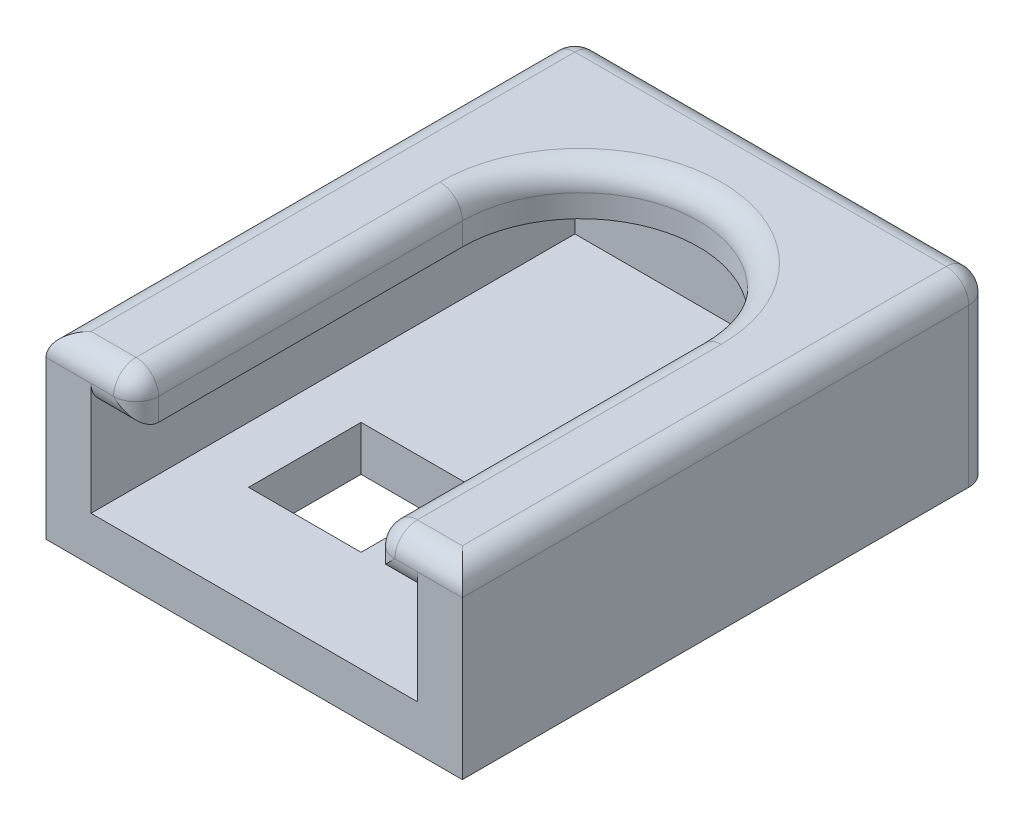
from build123d import *

# Parameters (mm, degrees)
SKETCH1_W           = 14.5
SKETCH1_H           = 21.5
BOSS_EXTRUDE1_DEPTH = 6
SHELL1_T            = 2
SKETCH3_W           = 2
SKETCH3_H           = 14.5
BOSS_EXTRUDE3_DEPTH = 2
SKETCH4_W           = 5
SKETCH4_H           = 5
CUT_EXTRUDE1_DEPTH  = 2
FILLET1_R           = 1


with BuildPart() as part:
    # Sketch1 → Boss-Extrude1 (new body)
    with BuildSketch(Plane(origin=(0, 0, 0), x_dir=(1, 0, 0), z_dir=(0, 1, 0))):
        Rectangle(SKETCH1_W, SKETCH1_H)
    extrude(amount=BOSS_EXTRUDE1_DEPTH)

    # Shell1
    shell1_openings = [part.faces().sort_by_distance(p)[0] for p in [
        (0, 3, 10.75),
        (0, 6, 0),
    ]]
    offset(amount=SHELL1_T, openings=shell1_openings, kind=Kind.INTERSECTION)

    # Sketch3 → Boss-Extrude3 (add)
    with BuildSketch(Plane(origin=(0, 6, 0), x_dir=(1, 0, 0), z_dir=(0, 1, 0))):
        with BuildLine():
            Line((-7.25, 10.75), (-7.25, 3.75))
            Line((-7.25, 3.75), (-5.25, 3.75))
            ThreePointArc((-5.25, 3.75), (0, 9), (5.25, 3.75))
            Line((5.25, 3.75), (7.25, 3.75))
            Line((7.25, 3.75), (7.25, 10.75))
            Line((7.25, 10.75), (-7.25, 10.75))
        make_face()
        with Locations((-6.25, -3.5)):
            Rectangle(SKETCH3_W, SKETCH3_H)
        with Locations((6.25, -3.5)):
            Rectangle(SKETCH3_W, SKETCH3_H)
    extrude(amount=-BOSS_EXTRUDE3_DEPTH)

    # Sketch4 → Cut-Extrude1 (cut)
    with BuildSketch(Plane(origin=(0, 0, 0), x_dir=(1, 0, 0), z_dir=(0, 1, 0))):
        with Locations((-2.25, -3.75)):
            Rectangle(SKETCH4_W, SKETCH4_H)
    extrude(amount=-CUT_EXTRUDE1_DEPTH, mode=Mode.SUBTRACT)

    # Fillet1
    fillet1_edges = [part.edges().sort_by_distance(p)[0] for p in [
        (-9.25, 6, -1),
        (-7.25, 6, 10.75),
        (7.25, 6, 10.75),
        (0, 6, -9),
        (-5.25, 6, 3.5),
        (-6.25, 4, 10.75),
        (-5.25, 5, 10.75),
        (5.25, 5, 10.75),
        (6.25, 4, 10.75),
        (5.25, 6, 3.5),
        (9.25, 6, -1),
        (-9.25, 2, -12.75),
        (9.25, 2, -12.75),
        (0, 6, -12.75),
    ]]
    fillet(fillet1_edges, radius=FILLET1_R - 0.0001)  # a hair under: the kernel refuses the full size


solid = part.part
